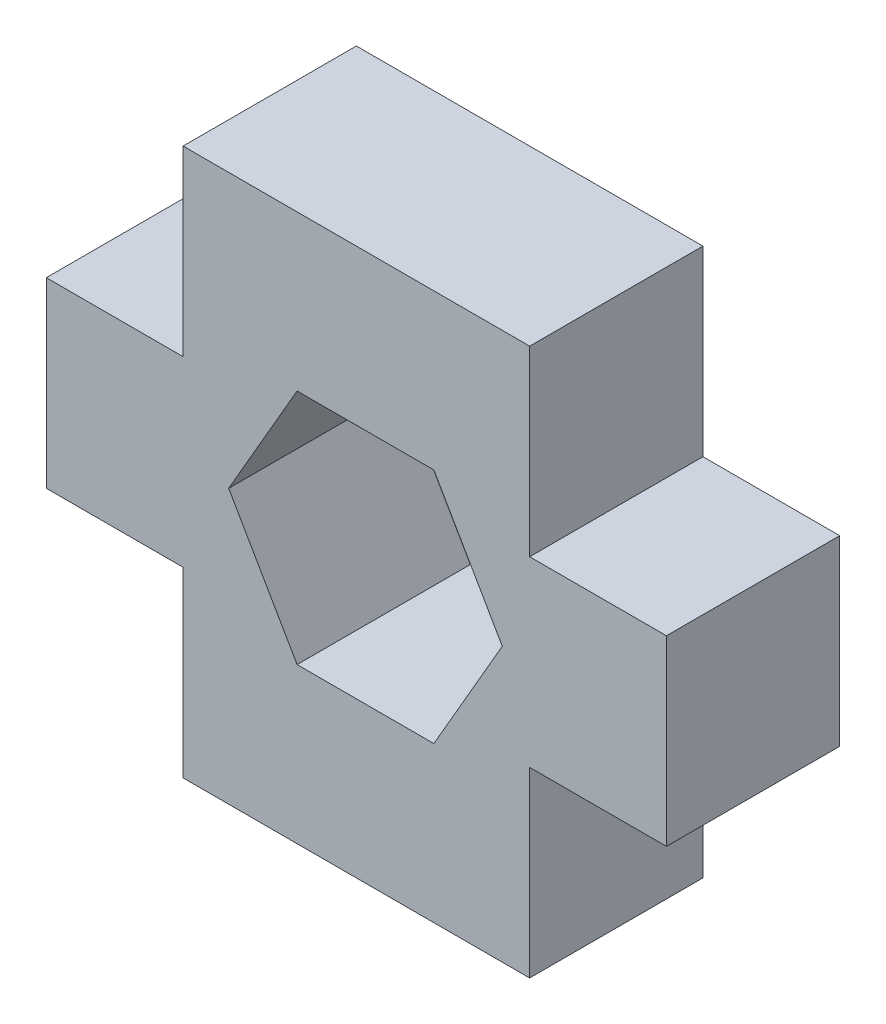
from build123d import *

# Parameters (mm, degrees)
BOSS_EXTRUDE1_DEPTH = 3.8


with BuildPart() as part:
    # Sketch1 → Boss-Extrude1 (new body)
    with BuildSketch(Plane.XY):
        Polygon((0, 0), (7.6, 0), (7.6, 4), (10.6, 4), (10.6, 8), (7.6, 8), (7.6, 12), (0, 12), (0, 8), (-3, 8), (-3, 4), (0, 4), align=None)
        Polygon((7, 6), (5.5, 8.598076211), (2.5, 8.598076211), (1, 6), (2.5, 3.401923789), (5.5, 3.401923789), align=None, mode=Mode.SUBTRACT)
    extrude(amount=BOSS_EXTRUDE1_DEPTH)


solid = part.part
